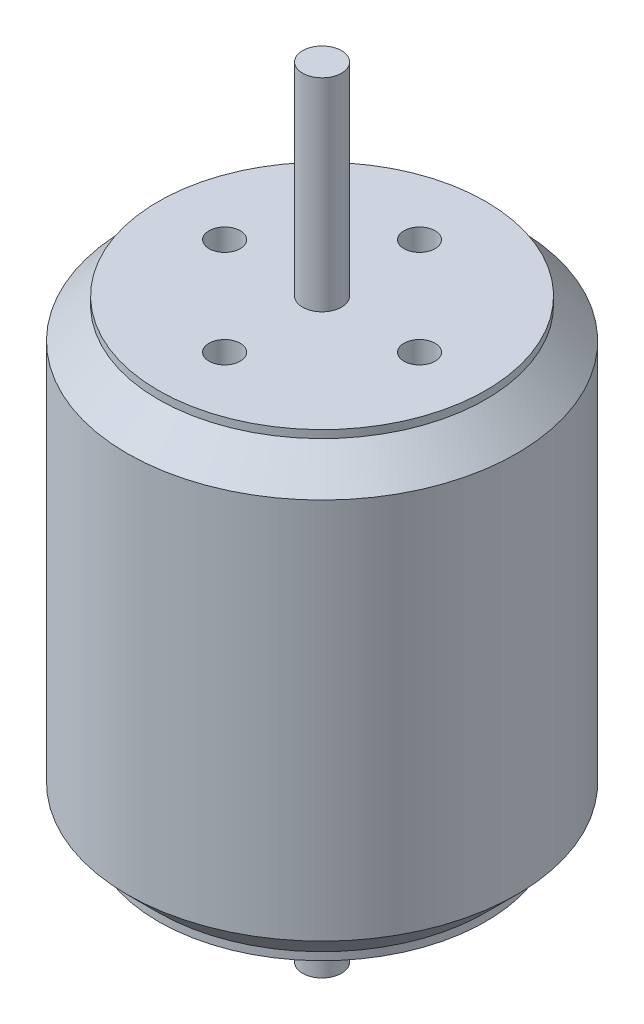
from build123d import *

# Parameters (mm, degrees)
SKETCH1_R           = 21
BOSS_EXTRUDE1_DEPTH = 59
SKETCH1_3_R         = 2.5
BOSS_EXTRUDE2_DEPTH = 26
SKETCH1_4_R         = 2
CUT_EXTRUDE1_DEPTH  = 10
BOSS_EXTRUDE3_START = -5
SKETCH1_5_R         = 25
SKETCH1_5_R_2       = 21
BOSS_EXTRUDE3_DEPTH = 49
CHAMFER1_SIZE       = 4
BOSS_EXTRUDE4_START = -74
SKETCH1_6_R         = 2.5
BOSS_EXTRUDE4_DEPTH = 15


with BuildPart() as part:
    # Sketch1 → Boss-Extrude1 (new body)
    with BuildSketch(Plane(origin=(0, 0, 0), x_dir=(1, 0, 0), z_dir=(0, 1, 0))):
        with Locations(Location((0, 0, 0), (0, 0, 270))):
            Circle(SKETCH1_R)
    extrude(amount=-BOSS_EXTRUDE1_DEPTH)

    # Sketch1<3> → Boss-Extrude2 (add)
    with BuildSketch(Plane(origin=(0, 0, 0), x_dir=(1, 0, 0), z_dir=(0, 1, 0))):
        with Locations(Location((0, 0, 0), (0, 0, 90))):
            Circle(SKETCH1_3_R)
    extrude(amount=BOSS_EXTRUDE2_DEPTH)

    # Sketch1<4> → Cut-Extrude1 (cut)
    with BuildSketch(Plane(origin=(0, 0, 0), x_dir=(1, 0, 0), z_dir=(0, 1, 0))):
        with Locations(Location((-12.5, 0, 0), (0, 0, 270))):
            Circle(SKETCH1_4_R)
        with Locations(Location((0, 12.5, 0), (0, 0, 270))):
            Circle(SKETCH1_4_R)
        with Locations(Location((12.5, 0, 0), (0, 0, 270))):
            Circle(SKETCH1_4_R)
        with Locations(Location((0, -12.5, 0), (0, 0, 270))):
            Circle(SKETCH1_4_R)
    extrude(amount=-CUT_EXTRUDE1_DEPTH, mode=Mode.SUBTRACT)

    # Sketch1<5> → Boss-Extrude3 (add)
    with BuildSketch(Plane(origin=(0, 0, 0), x_dir=(1, 0, 0), z_dir=(0, 1, 0)).offset(BOSS_EXTRUDE3_START)):
        with Locations(Location((0, 0, 0), (0, 0, 270))):
            Circle(SKETCH1_5_R)
        with Locations(Location((0, 0, 0), (0, 0, 270))):
            Circle(SKETCH1_5_R_2, mode=Mode.SUBTRACT)
    extrude(amount=-BOSS_EXTRUDE3_DEPTH)

    # Chamfer1
    chamfer1_edges = [part.edges().sort_by_distance(p)[0] for p in [
        (0, -5, -21),
        (0, -54, -21),
    ]]
    chamfer(chamfer1_edges, length=CHAMFER1_SIZE - 0.0001)  # a hair under: the kernel refuses the full size

    # Sketch1<6> → Boss-Extrude4 (add)
    with BuildSketch(Plane(origin=(0, 0, 0), x_dir=(1, 0, 0), z_dir=(0, 1, 0)).offset(BOSS_EXTRUDE4_START)):
        with Locations(Location((0, 0, 0), (0, 0, 90))):
            Circle(SKETCH1_6_R)
    extrude(amount=BOSS_EXTRUDE4_DEPTH)


solid = part.part
